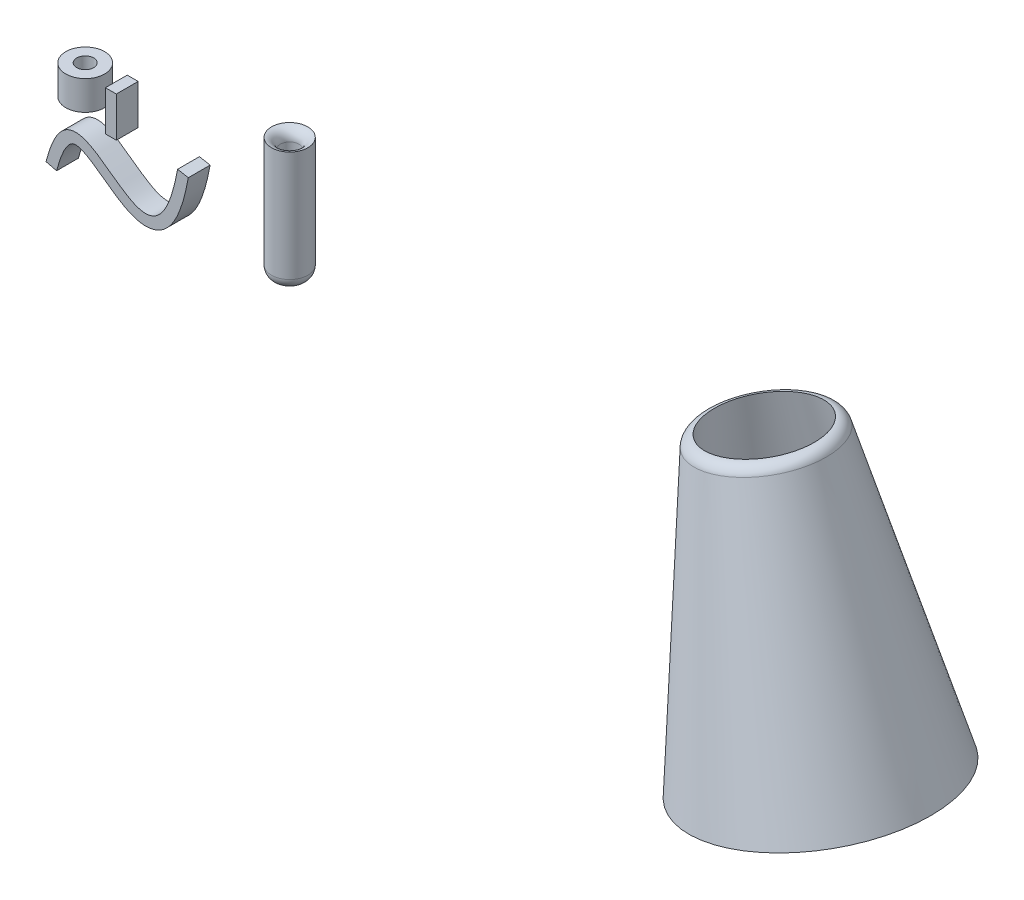
from build123d import *

# Parameters (mm, degrees)
EXTRUDE_THIN1_OUTLINE_W = 9.999999999999993
EXTRUDE_THIN1_OUTLINE_H = 36.710134862
EXTRUDE_THIN1_DEPTH     = 20
SKETCH3_W               = 10
SKETCH3_H               = 26.81861266200005
SKETCH4_W               = 8
SKETCH4_H               = 111.0463440008494
FILLET1_R               = 10
FILLET2_R               = 10
FILLET6_R               = 10
FILLET7_R               = 10


# Read off the part's stored shape, not the designer's step: Extrude-Thin1
with BuildPart() as part:
    # Extrude-Thin1 outline → Extrude-Thin1 (new body)
    with BuildSketch(Plane.XY):
        with Locations((59.489938632999994, 67.579713016)):
            Rectangle(EXTRUDE_THIN1_OUTLINE_W, EXTRUDE_THIN1_OUTLINE_H)
        with BuildLine():
            Line((0, 0), (9.694909236, -2.4512721))
            add(Edge.make_bspline(
                [(9.694909236, -2.4512721), (10.5311688474778, 0.856178359172851), (11.394386774256, 3.84419741254524), (13.1533592305206, 9.20694051284605), (14.0492896362296, 11.5815145840632), (15.8413121087331, 15.742658734528), (16.737517517862, 17.5287647227855), (18.4814345025707, 20.5463967391919), (19.3286793802721, 21.7769702062188), (20.9123918030556, 23.7460025130972), (21.6468668792936, 24.4838050755776), (22.9626621572418, 25.5880403665081), (23.5417164826069, 25.9567946857274), (24.5982667995349, 26.4876499635343), (25.0784708138462, 26.6536744426382), (26.0947773614352, 26.8786677388824), (26.6354672734258, 26.9362581428574), (27.9016220528546, 26.9202105728274), (28.6267698076733, 26.8433228296364), (30.2827198681421, 26.501626749094), (31.2115323200941, 26.2360905599305), (33.2381790124912, 25.4970253861064), (34.3350401710325, 25.0239655597566), (36.6545545212303, 23.8839035231942), (37.8770010886368, 23.2173466425486), (40.413779447504, 21.7212794308362), (41.7281493534382, 20.8920027901708), (44.4249998964398, 19.1079431631433), (45.8075500630837, 18.1532614063299), (50.0335414120897, 15.1597754687626), (52.9529117796699, 12.9920070265115), (58.9368445543254, 8.62200824840444), (62.0007966750851, 6.41938014676282), (66.7257978693274, 3.31532694879324), (68.3230359680193, 2.313869999449), (71.5770117142215, 0.417572758509964), (73.2337136485033, -0.477527792876216), (76.6317569670157, -2.11375987107278), (78.3733528188264, -2.85538269335876), (81.9745983323873, -4.11884560626711), (83.8353857946341, -4.64115314789327), (87.6984061214208, -5.36551199552065), (89.7028005800273, -5.56654784071354), (92.7872249227571, -5.52733551388739), (93.8275778829024, -5.45729724278707), (95.9174101948477, -5.18908376162479), (96.9667901072056, -4.99079603224231), (99.0536589714669, -4.45778102161726), (100.0909704087, -4.12302677221439), (102.131284140322, -3.3172969507252), (103.13412254263, -2.84641134529941), (106.063715631323, -1.24117058796995), (107.907320493612, 0.0849084234402593), (111.324584701444, 3.16057354469398), (112.900958390548, 4.90829500464283), (115.827345406093, 8.7851531963294), (117.179193265889, 10.9152075498616), (119.713037579898, 15.5776997205682), (120.895351993834, 18.1110774147558), (123.128090663281, 23.6279089006282), (124.178355260339, 26.6117757902841), (127.162248988825, 36.3184054964138), (128.931571554216, 43.7980034470408), (130.507605163, 52.487115477)],
                knots=[0, 0, 0, 0, 0.03125, 0.03125, 0.0624999999999999, 0.0624999999999999, 0.0937499999999999, 0.0937499999999999, 0.125, 0.125, 0.15625, 0.15625, 0.1875, 0.1875, 0.21875, 0.21875, 0.25, 0.25, 0.28125, 0.28125, 0.3125, 0.3125, 0.34375, 0.34375, 0.375, 0.375, 0.40625, 0.40625, 0.4375, 0.4375, 0.5, 0.5, 0.5625, 0.5625, 0.59375, 0.59375, 0.625, 0.625, 0.65625, 0.65625, 0.6875, 0.6875, 0.71875, 0.71875, 0.734375, 0.734375, 0.75, 0.75, 0.765625, 0.765625, 0.78125, 0.78125, 0.8125, 0.8125, 0.84375, 0.84375, 0.875, 0.875, 0.90625, 0.90625, 0.9375, 0.9375, 1, 1, 1, 1], degree=3))
            Line((130.507605163, 52.487115477), (120.668148619, 54.2717989))
            add(Edge.make_bspline(
                [(0, 0), (28.3563158244911, 112.15071072711), (96.3343394540236, -79.8872652449302), (120.668148619, 54.2717989)],
                knots=[0, 0, 0, 0, 1, 1, 1, 1], degree=3))
        make_face()
    extrude(amount=EXTRUDE_THIN1_DEPTH)


with BuildPart() as body_2:
    # Sketch3 → Revolve-Thin1 (revolve)
    with BuildSketch(Plane.XY, mode=Mode.PRIVATE) as revolve_thin1_sk:
        with Locations((3.1706102671758742, 63.03237569384922)):
            Rectangle(SKETCH3_W, SKETCH3_H)
    revolve(revolve_thin1_sk.sketch.rotate(Axis((15.961492157812756, 76.44168202484924, 0), (0, -1, 0)), 270), axis=Axis((15.961492157812756, 76.44168202484924, 0), (0, -1, 0)))


with BuildPart() as body_3:
    # Sketch4 → Revolve-Thin2 (revolve)
    with BuildSketch(Plane.XY, mode=Mode.PRIVATE) as revolve_thin2_sk:
        with Locations((190.84042517006557, 55.5231720004247)):
            Rectangle(SKETCH4_W, SKETCH4_H)
    revolve(revolve_thin2_sk.sketch.rotate(Axis((203.4521186248573, 111.04634400084939, 0), (0, -1, 0)), 270), axis=Axis((203.4521186248573, 111.04634400084939, 0), (0, -1, 0)))

    # Fillet1
    # the kernel refuses this fillet: 10 mm, written as the material it takes off along each edge
    with BuildSketch(Plane(origin=(203.4521186248573, 111.04634400084939, 0), x_dir=(0, 0, 1), z_dir=(1, 0, 0))) as fillet1_piece_1:
        with BuildLine():
            CenterArc((18.61169345479169, 9.797958971132715), FILLET1_R, 180, 78.4630409671845)
            Line((16.61169345479169, 0), (16.571693454791692, -0.19595917942265828))
            ThreePointArc((16.571693454791692, -0.19595917942265828), (12.611693454791691, -0.20000000000000284), (8.611693454791691, -0.20000000000000284))
            Line((8.611693454791691, -0.20000000000000284), (8.411693454791692, 0))
            Line((8.411693454791692, 0), (8.411693454791692, 9.797958971132715))
            Line((8.411693454791692, 9.797958971132715), (8.611693454791691, 9.797958971132715))
        make_face()
    revolve(axis=Axis((203.4521186248573, 111.04634400084939, 0), (0, -1, 0)), mode=Mode.SUBTRACT)

    # Fillet2
    # the kernel refuses this fillet: 10 mm, written as the material it takes off along each edge
    with BuildSketch(Plane(origin=(203.4521186248573, 0, 0), x_dir=(1.71e-15, 0, 1), z_dir=(1, 0, -1.71e-15))) as fillet2_piece_1:
        with BuildLine():
            CenterArc((6.611693454791691, -9.797958971132712), FILLET2_R, 0, 78.4630409671845)
            Line((16.61169345479169, -9.797958971132712), (16.81169345479169, -9.797958971132712))
            Line((16.81169345479169, -9.797958971132712), (16.81169345479169, 0))
            Line((16.81169345479169, 0), (16.61169345479169, 0.2))
            ThreePointArc((16.61169345479169, 0.2), (12.611693454791691, 0.2), (8.65169345479169, 0.19595917942265426))
            Line((8.65169345479169, 0.19595917942265426), (8.611693454791691, 0))
        make_face()
    revolve(axis=Axis((203.4521186248573, 0, 0), (0, -1, 0)), mode=Mode.SUBTRACT)


with BuildPart() as body_4:
    # Sketch8 → Revolve-Thin3 (revolve)
    with BuildSketch(Plane.XY):
        Polygon((592.9165543990568, 90.62123521338879), (597.1368581551377, -174.65500088312245), (589.1378703596948, -174.78225750714086), (584.917566603614, 90.49397858937037), align=None)
    revolve(axis=Axis((640.5456967891123, 90.62123521338879, 0), (0.19878243707787766, -0.9800436432676759, 0)))

    # Fillet6
    # the kernel refuses this fillet: 10 mm, written as the material it takes off along each edge
    with BuildSketch(Plane(origin=(638.3723729729767, 101.33622705108073, 0), x_dir=(-0.9800436432676759, -0.19878243707787757, 0), z_dir=(0, 0, 1))) as fillet6_piece_1:
        with BuildLine():
            CenterArc((46.507144024662985, 11.463870621378966), FILLET6_R, 270.9826376087404, 78.46304096718501)
            Line((46.67863823366485, 1.465341242701382), (46.68206811784489, 1.2653706551278228))
            ThreePointArc((46.68206811784489, 1.2653706551278228), (50.57433146427542, 0.5360542832667986), (54.50665822595351, -0.19661633808389894))
            Line((54.50665822595351, -0.19661633808389894), (54.739908095105, -0.03663353106753944))
            Line((54.739908095105, -0.03663353106753944), (56.534577266942115, 9.595560536934707))
            Line((56.534577266942115, 9.595560536934707), (56.33796092885816, 9.632194068002248))
        make_face()
    revolve(axis=Axis((638.3723729729767, 101.33622705108073, 0), (0.19878243707787766, -0.9800436432676759, 0)), mode=Mode.SUBTRACT)

    # Fillet7
    # the kernel refuses this fillet: 10 mm, written as the material it takes off along each edge
    with BuildSketch(Plane(origin=(690.5103330727782, -155.71604134794063, 0), x_dir=(-0.9800436432676758, -0.19878243707787768, 0), z_dir=(0, 0, 0.9999999999999999))) as fillet7_piece_1:
        with BuildLine():
            CenterArc((103.31096080732812, -11.463870621378936), FILLET7_R, 90.98263760874039, 78.46304096718495)
            Line((103.13946659832625, -1.4653412427013406), (103.1360367141462, -1.265370655127797))
            ThreePointArc((103.1360367141462, -1.265370655127797), (99.24377336771579, -0.5360542832668204), (95.31144660603758, 0.19661633808389678))
            Line((95.31144660603758, 0.19661633808389678), (95.07819673688608, 0.03663353106753908))
            Line((95.07819673688608, 0.03663353106753908), (93.28352756504898, -9.595560536934663))
            Line((93.28352756504898, -9.595560536934663), (93.48014390313294, -9.632194068002203))
        make_face()
    revolve(axis=Axis((690.5103330727782, -155.71604134794063, 0), (0.19878243707787766, -0.9800436432676759, 0)), mode=Mode.SUBTRACT)


solid = Compound([part.part, body_2.part, body_3.part, body_4.part])
